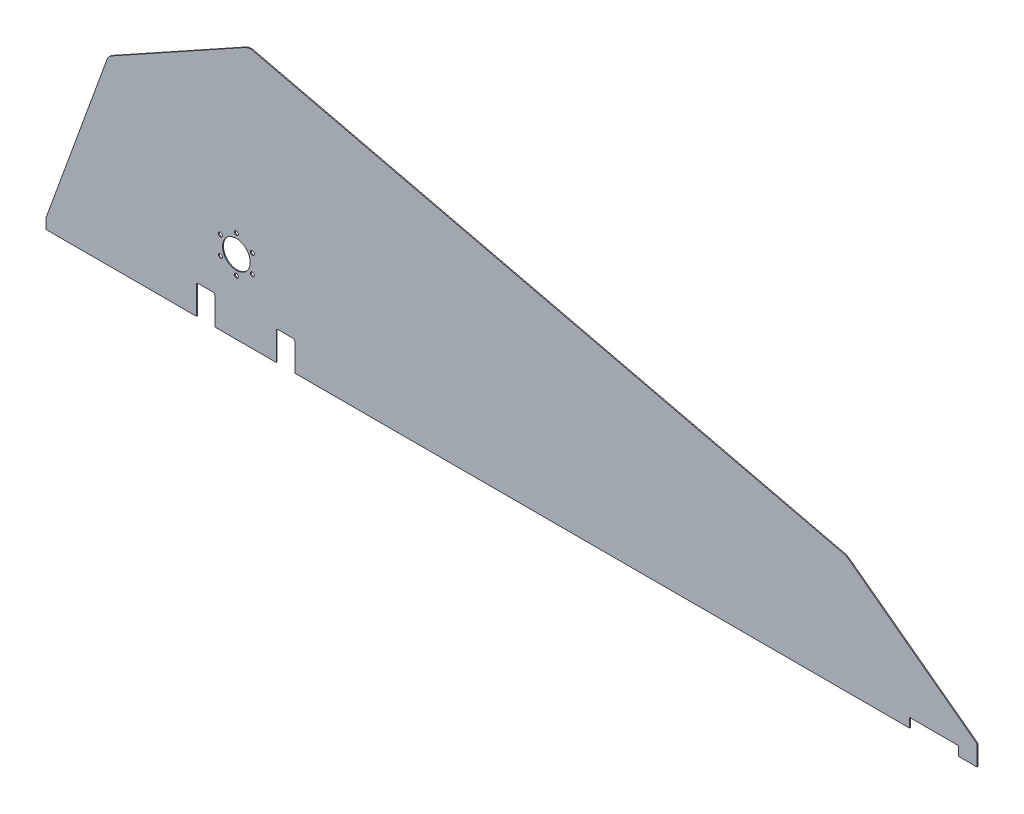
from build123d import *

# Parameters (mm, degrees)
SKETCH_1_R             = 3.25
SKETCH_1_R_2           = 22.5
SM_BASE_FLANGE_1_DEPTH = 1.5


# Sheet-metal steps are written as plain solids
with BuildPart() as part:
    # Sketch 1 → Базовая кромка1 (new body)
    with BuildSketch(Plane.XY):
        with BuildLine():
            Line((677.266802552, -1.5), (677.266802552, -16.5))
            Line((677.266802552, -16.5), (-322.733197448, -16.5))
            Line((-322.733197448, -16.5), (-322.733197448, 4.22618932))
            Line((-322.733197448, 4.22618932), (-322.733197448, 28.22618932))
            ThreePointArc((-322.733197448, 28.22618932), (-323.611877105, 30.347509663), (-325.733197448, 31.22618932))
            Line((-325.733197448, 31.22618932), (-349.733197448, 31.22618932))
            ThreePointArc((-349.733197448, 31.22618932), (-351.854517792, 30.347509663), (-352.733197448, 28.22618932))
            Line((-352.733197448, 28.22618932), (-352.733197448, 4.22618932))
            Line((-352.733197448, 4.22618932), (-352.733197448, -16.5))
            Line((-352.733197448, -16.5), (-452.733197448, -16.5))
            Line((-452.733197448, -16.5), (-452.733197448, 4.22618932))
            Line((-452.733197448, 4.22618932), (-452.733197448, 28.22618932))
            ThreePointArc((-452.733197448, 28.22618932), (-453.611877105, 30.347509663), (-455.733197448, 31.22618932))
            Line((-455.733197448, 31.22618932), (-479.733197448, 31.22618932))
            ThreePointArc((-479.733197448, 31.22618932), (-481.854517792, 30.347509663), (-482.733197448, 28.22618932))
            Line((-482.733197448, 28.22618932), (-482.733197448, 4.22618932))
            Line((-482.733197448, 4.22618932), (-482.733197448, -16.5))
            Line((-482.733197448, -16.5), (-727.412308586, -16.5))
            Line((-727.412308586, -16.5), (-727.412308586, 0))
            Line((-727.412308586, 0), (-665.607683437, 169.806812014))
            Line((-665.607683437, 169.806812014), (-628.27182662, 272.386235556))
            ThreePointArc((-628.27182662, 272.386235556), (-625.181995264, 277.685039029), (-620.432527225, 281.566653306))
            Line((-620.432527225, 281.566653306), (-403.291964068, 401.983925448))
            ThreePointArc((-403.291964068, 401.983925448), (-397.280386008, 403.986243464), (-390.951446304, 403.681496942))
            Line((-390.951446304, 403.681496942), (571.017994956, 175.466516041))
            ThreePointArc((571.017994956, 175.466516041), (574.328905861, 174.314751992), (577.338388414, 172.517057299))
            Line((577.338388414, 172.517057299), (643.325554365, 123.355108982))
            Line((643.325554365, 123.355108982), (787.266802552, 16.115585934))
            Line((787.266802552, 16.115585934), (787.266802552, -16.5))
            Line((787.266802552, -16.5), (757.266802552, -16.5))
            Line((757.266802552, -16.5), (757.266802552, -1.5))
            Line((757.266802552, -1.5), (677.266802552, -1.5))
        make_face()
        with Locations((-417.733197448, 133.22618932)):
            Circle(SKETCH_1_R, mode=Mode.SUBTRACT)
        with Locations((-417.733197448, 103.22618932)):
            Circle(SKETCH_1_R_2, mode=Mode.SUBTRACT)
        with Locations((-391.752435335, 118.22618932)):
            Circle(SKETCH_1_R, mode=Mode.SUBTRACT)
        with Locations((-391.752435335, 88.22618932)):
            Circle(SKETCH_1_R, mode=Mode.SUBTRACT)
        with Locations((-417.733197448, 73.22618932)):
            Circle(SKETCH_1_R, mode=Mode.SUBTRACT)
        with Locations((-443.713959562, 88.22618932)):
            Circle(SKETCH_1_R, mode=Mode.SUBTRACT)
        with Locations((-443.713959562, 118.22618932)):
            Circle(SKETCH_1_R, mode=Mode.SUBTRACT)
    extrude(amount=SM_BASE_FLANGE_1_DEPTH)


solid = part.part
